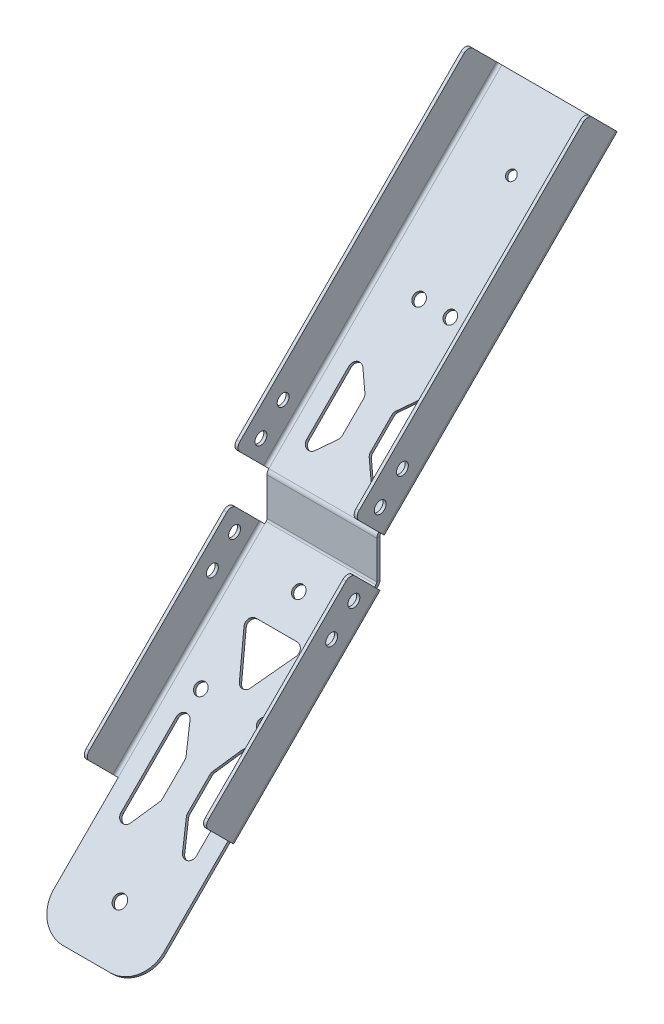
from build123d import *

# Parameters (mm, degrees)
BASE_FLANGE1_DEPTH     = 1
SKETCHED_START         = -32.5
SKETCHED_BEND5_DEPTH   = 65
SKETCHED_BEND5_2_DEPTH = 15
SKETCHED_START_2       = 17.5
SKETCHED_BEND5_3_DEPTH = 15
SKETCHED_BEND5_4_DEPTH = 65
SKETCHED_START_3       = -17.5
SKETCHED_BEND5_5_DEPTH = 35
SKETCHED_BEND6_DEPTH   = 65
SKETCHED_BEND6_2_DEPTH = 15
SKETCHED_BEND6_3_DEPTH = 15
SKETCHED_BEND6_4_DEPTH = 65
SKETCHED_BEND6_5_DEPTH = 35
SKETCHED_START_4       = -71.356310605
SKETCHED_BEND7_DEPTH   = 66
SKETCHED_BEND7_2_DEPTH = 66
SKETCHED_START_5       = 5.890889039
SKETCHED_BEND8_DEPTH   = 105
SKETCHED_BEND8_2_DEPTH = 105
F_6_CLEARANCE_HOLE2_D  = 3.7973
CUT_EXTRUDE1_REACH     = 121.977
SKETCH16_R             = 1.525
CUT_EXTRUDE2_REACH     = 127.221
SKETCH31_R             = 2.025
F_6_CLEARANCE_HOLE4_D  = 3.7973
F_6_CLEARANCE_HOLE5_D  = 3.7973
FILLET1_R              = 10
FILLET2_R              = 2


# Read off the part's stored shape, not the designer's step: Sketched Bend5, Sketched Bend6, Sketched Bend7, Sketched Bend8
# Sheet-metal steps are written as plain solids
with BuildPart() as part:
    # Sketch1 → Base-Flange1 (new body)
    with BuildSketch(Plane.XY):
        Polygon((-32.5, -73.5), (-17.5, -73.5), (-17.5, -112.5), (17.5, -112.5), (17.5, -73.5), (32.5, -73.5), (32.5, -7.5), (17.5, -7.5), (17.5, 7.5), (32.5, 7.5), (32.5, 112.5), (17.5, 112.5), (-17.5, 112.5), (-32.5, 112.5), (-32.5, 7.5), (-17.5, 7.5), (-17.5, -7.5), (-32.5, -7.5), align=None)
    extrude(amount=-BASE_FLANGE1_DEPTH)

    # Sketched Bend5 outline → Sketched Bend5 (cut)
    with BuildSketch(Plane.YZ.offset(SKETCHED_START)):
        with BuildLine():
            Line((7.714213562, -0.585786438), (8.128427124, -1))
            Line((8.128427124, -1), (112.5, -1))
            Line((112.5, -1), (112.5, 0))
            Line((112.5, 0), (6.3, 0))
            ThreePointArc((6.3, 0), (7.065366865, -0.152240935), (7.714213562, -0.585786438))
        make_face()
    extrude(amount=SKETCHED_BEND5_DEPTH, mode=Mode.SUBTRACT)

    # Sketched Bend5 2 outline → Sketched Bend5 2 (cut)
    with BuildSketch(Plane.YZ.offset(SKETCHED_START)):
        with BuildLine():
            Line((7.729701149, -0.601274024), (7.714213562, -0.585786438))
            ThreePointArc((7.714213562, -0.585786438), (7.610403483, -0.48909209), (7.5, -0.4))
            Line((7.5, -0.4), (7.5, -0.830975173))
            Line((7.5, -0.830975173), (7.729701149, -0.601274024))
        make_face()
    extrude(amount=SKETCHED_BEND5_2_DEPTH, mode=Mode.SUBTRACT)

    # Sketched Bend5 3 outline → Sketched Bend5 3 (cut)
    with BuildSketch(Plane.YZ.offset(SKETCHED_START_2)):
        with BuildLine():
            Line((7.729701149, -0.601274024), (7.714213562, -0.585786438))
            ThreePointArc((7.714213562, -0.585786438), (7.610403483, -0.48909209), (7.5, -0.4))
            Line((7.5, -0.4), (7.5, -0.830975173))
            Line((7.5, -0.830975173), (7.729701149, -0.601274024))
        make_face()
    extrude(amount=SKETCHED_BEND5_3_DEPTH, mode=Mode.SUBTRACT)

    # Sketched Bend5 4 outline → Sketched Bend5 4 (add)
    with BuildSketch(Plane.YZ.offset(SKETCHED_START)):
        Polygon((81.975913173, -74.847486049), (8.128427124, -1), (7.5, -1), (7.5, -0.830975173), (7.022594368, -1.308380805), (81.268806392, -75.55459283), align=None)
    extrude(amount=SKETCHED_BEND5_4_DEPTH)

    # Sketched Bend5 5 outline → Sketched Bend5 5 (add)
    with BuildSketch(Plane.YZ.offset(SKETCHED_START_3)):
        with BuildLine():
            Line((7.022594368, -1.308380805), (7.330975173, -1))
            Line((7.330975173, -1), (6.3, -1))
            ThreePointArc((6.3, -1), (6.682683432, -1.076120467), (7.007106781, -1.292893219))
            Line((7.007106781, -1.292893219), (7.022594368, -1.308380805))
        make_face()
    extrude(amount=SKETCHED_BEND5_5_DEPTH)

    # Sketched Bend6 outline → Sketched Bend6 (cut)
    with BuildSketch(Plane.YZ.offset(SKETCHED_START)):
        with BuildLine():
            ThreePointArc((-5.710951377, -1), (-6.476318242, -0.847759065), (-7.12516494, -0.414213562))
            Line((-7.12516494, -0.414213562), (-7.539378502, 0))
            Line((-7.539378502, 0), (-112.5, 0))
            Line((-112.5, 0), (-112.5, -1))
            Line((-112.5, -1), (-5.710951377, -1))
        make_face()
    extrude(amount=SKETCHED_BEND6_DEPTH, mode=Mode.SUBTRACT)

    # Sketched Bend6 2 outline → Sketched Bend6 2 (cut)
    with BuildSketch(Plane.YZ.offset(SKETCHED_START)):
        Polygon((-7.539378502, 0), (-7.5, -0.039378502), (-7.5, 0), align=None)
    extrude(amount=SKETCHED_BEND6_2_DEPTH, mode=Mode.SUBTRACT)

    # Sketched Bend6 3 outline → Sketched Bend6 3 (cut)
    with BuildSketch(Plane.YZ.offset(SKETCHED_START_2)):
        Polygon((-7.539378502, 0), (-7.5, -0.039378502), (-7.5, 0), align=None)
    extrude(amount=SKETCHED_BEND6_3_DEPTH, mode=Mode.SUBTRACT)



with BuildPart() as body_2:
    # Sketched Bend6 4 outline → Sketched Bend6 4 (new body)
    with BuildSketch(Plane.YZ.offset(SKETCHED_START)):
        Polygon((-54.22622036, 46.686841858), (-7.557172802, 0.0177943), (-6.850066021, 0.724901081), (-53.519113579, 47.393948639), align=None)
    extrude(amount=SKETCHED_BEND6_4_DEPTH)


with BuildPart() as part_1:
    add(part.part)

    add(body_2.part)  # Sketched Bend6 5 merges body 2
    # Sketched Bend6 5 outline → Sketched Bend6 5 (add)
    with BuildSketch(Plane.YZ.offset(SKETCHED_START_3)):
        with BuildLine():
            Line((-7.557172802, 0.0177943), (-7.539378502, 0))
            Line((-7.539378502, 0), (-5.710951377, 0))
            ThreePointArc((-5.710951377, 0), (-6.09363481, 0.076120467), (-6.418058159, 0.292893219))
            Line((-6.418058159, 0.292893219), (-6.850066021, 0.724901081))
            Line((-6.850066021, 0.724901081), (-7.557172802, 0.0177943))
        make_face()
        Polygon((-81.803384826, 74.264006324), (-54.22622036, 46.686841858), (-53.519113579, 47.393948639), (-81.096278045, 74.971113105), align=None)
    extrude(amount=SKETCHED_BEND6_5_DEPTH)

    # Sketched Bend7 outline → Sketched Bend7 (cut)
    with BuildSketch(Plane(origin=(0, 0, 0), x_dir=(1, 0, 0), z_dir=(0, 0.707106781186546, -0.707106781186549)).offset(SKETCHED_START_4)):
        with BuildLine():
            ThreePointArc((-19.232050807, 4.331145665), (-18.5, 5.063196472), (-17.5, 5.331145665))
            Line((-17.5, 5.331145665), (-32.5, 5.331145665))
            Line((-32.5, 5.331145665), (-32.5, 4.331145665))
            Line((-32.5, 4.331145665), (-19.232050807, 4.331145665))
        make_face()
        with BuildLine():
            Line((32.5, 5.331145665), (17.5, 5.331145665))
            ThreePointArc((17.5, 5.331145665), (18.5, 5.063196472), (19.232050807, 4.331145665))
            Line((19.232050807, 4.331145665), (32.5, 4.331145665))
            Line((32.5, 4.331145665), (32.5, 5.331145665))
        make_face()
    extrude(amount=SKETCHED_BEND7_DEPTH, mode=Mode.SUBTRACT)

    # Sketched Bend7 2 outline → Sketched Bend7 2 (add)
    with BuildSketch(Plane(origin=(0, 0, 0), x_dir=(1, 0, 0), z_dir=(0, 0.707106781186546, -0.707106781186549)).offset(SKETCHED_START_4)):
        with BuildLine():
            Line((-17.5, 4.331145665), (-19.232050807, 4.331145665))
            ThreePointArc((-19.232050807, 4.331145665), (-19.431851652, 3.848783755), (-19.5, 3.331145665))
            Line((-19.5, 3.331145665), (-19.5, -9.312659845))
            Line((-19.5, -9.312659845), (-18.5, -9.312659845))
            Line((-18.5, -9.312659845), (-18.5, 3.331145665))
            ThreePointArc((-18.5, 3.331145665), (-18.207106781, 4.038252446), (-17.5, 4.331145665))
        make_face()
        with BuildLine():
            ThreePointArc((19.5, 3.331145665), (19.431851652, 3.848783755), (19.232050807, 4.331145665))
            Line((19.232050807, 4.331145665), (17.5, 4.331145665))
            ThreePointArc((17.5, 4.331145665), (18.207106781, 4.038252446), (18.5, 3.331145665))
            Line((18.5, 3.331145665), (18.5, -9.312659845))
            Line((18.5, -9.312659845), (19.5, -9.312659845))
            Line((19.5, -9.312659845), (19.5, 3.331145665))
        make_face()
    extrude(amount=SKETCHED_BEND7_2_DEPTH)

    # Sketched Bend8 outline → Sketched Bend8 (cut)
    with BuildSketch(Plane(origin=(0, 0, 0), x_dir=(1, 0, 0), z_dir=(0, 0.707106781186546, -0.707106781186549)).offset(SKETCHED_START_5)):
        with BuildLine():
            Line((-32.5, -5.040559159), (-19.232050807, -5.040559159))
            ThreePointArc((-19.232050807, -5.040559159), (-18.5, -4.308508352), (-17.5, -4.040559159))
            Line((-17.5, -4.040559159), (-32.5, -4.040559159))
            Line((-32.5, -4.040559159), (-32.5, -5.040559159))
        make_face()
        with BuildLine():
            Line((32.5, -4.040559159), (17.5, -4.040559159))
            ThreePointArc((17.5, -4.040559159), (18.5, -4.308508352), (19.232050807, -5.040559159))
            Line((19.232050807, -5.040559159), (32.5, -5.040559159))
            Line((32.5, -5.040559159), (32.5, -4.040559159))
        make_face()
    extrude(amount=SKETCHED_BEND8_DEPTH, mode=Mode.SUBTRACT)

    # Sketched Bend8 2 outline → Sketched Bend8 2 (add)
    with BuildSketch(Plane(origin=(0, 0, 0), x_dir=(1, 0, 0), z_dir=(0, 0.707106781186546, -0.707106781186549)).offset(SKETCHED_START_5)):
        with BuildLine():
            ThreePointArc((-19.232050807, -5.040559159), (-19.431851652, -5.522921069), (-19.5, -6.040559159))
            Line((-19.5, -6.040559159), (-19.5, -18.684364669))
            Line((-19.5, -18.684364669), (-18.5, -18.684364669))
            Line((-18.5, -18.684364669), (-18.5, -6.040559159))
            ThreePointArc((-18.5, -6.040559159), (-18.207106781, -5.333452378), (-17.5, -5.040559159))
            Line((-17.5, -5.040559159), (-19.232050807, -5.040559159))
        make_face()
        with BuildLine():
            Line((19.232050807, -5.040559159), (17.5, -5.040559159))
            ThreePointArc((17.5, -5.040559159), (18.207106781, -5.333452378), (18.5, -6.040559159))
            Line((18.5, -6.040559159), (18.5, -18.684364669))
            Line((18.5, -18.684364669), (19.5, -18.684364669))
            Line((19.5, -18.684364669), (19.5, -6.040559159))
            ThreePointArc((19.5, -6.040559159), (19.431851652, -5.522921069), (19.232050807, -5.040559159))
        make_face()
    extrude(amount=SKETCHED_BEND8_2_DEPTH)

    # #6 Clearance Hole2 (through all)
    with Locations(Plane(origin=(19.5, 0, 0), x_dir=(0, 0, -1), z_dir=(1, 0, 0))):
        with Locations((-9.311868306, -5.334166607), (-16.382936118, -12.405234419), (-0.914625389, 16.316668374), (6.156442422, 23.387736186)):
            Hole(F_6_CLEARANCE_HOLE2_D / 2)

    # Sketch16 → Cut-Extrude1 (cut, up to next)
    with BuildSketch(Plane(origin=(0, 3.564213562, 3.564213562), x_dir=(1, 0, 0), z_dir=(0, 0.7071067811865487, 0.7071067811865465)), mode=Mode.PRIVATE) as cut_extrude1_sk1:
        with Locations(Location((0, 90.430889039, 0), (0, 0, 270))):
            Circle(SKETCH16_R)
    cut_extrude1_tool1 = extrude(cut_extrude1_sk1.sketch, amount=-CUT_EXTRUDE1_REACH, mode=Mode.PRIVATE) & part_1.part
    # Sketch16 → Cut-Extrude1 (cut, up to next)
    with BuildSketch(Plane(origin=(0, 3.564213562, 3.564213562), x_dir=(1, 0, 0), z_dir=(0, 0.7071067811865487, 0.7071067811865465)), mode=Mode.PRIVATE) as cut_extrude1_sk2:
        with BuildLine():
            Line((-12.5, 34.910953453), (-12.5, 15.870824627))
            ThreePointArc((-12.5, 15.870824627), (-11.185694979, 13.992042469), (-8.970177604, 14.582553136))
            Line((-8.970177604, 14.582553136), (-4.970177604, 19.332553136))
            ThreePointArc((-4.970177604, 19.332553136), (-4.621217842, 19.935129648), (-4.5, 20.620824627))
            Line((-4.5, 20.620824627), (-4.5, 30.160953453))
            ThreePointArc((-4.5, 30.160953453), (-4.621217842, 30.846648432), (-4.970177604, 31.449224944))
            Line((-4.970177604, 31.449224944), (-8.970177604, 36.199224944))
            ThreePointArc((-8.970177604, 36.199224944), (-11.185694979, 36.789735611), (-12.5, 34.910953453))
        make_face()
    cut_extrude1_tool2 = extrude(cut_extrude1_sk2.sketch, amount=-CUT_EXTRUDE1_REACH, mode=Mode.PRIVATE) & part_1.part
    # Sketch16 → Cut-Extrude1 (cut, up to next)
    with BuildSketch(Plane(origin=(0, 3.564213562, 3.564213562), x_dir=(1, 0, 0), z_dir=(0, 0.7071067811865487, 0.7071067811865465)), mode=Mode.PRIVATE) as cut_extrude1_sk3:
        with BuildLine():
            Line((4.5, 20.620824627), (4.5, 30.160953453))
            ThreePointArc((4.5, 30.160953453), (4.621217842, 30.846648432), (4.970177604, 31.449224944))
            Line((4.970177604, 31.449224944), (8.970177604, 36.199224944))
            ThreePointArc((8.970177604, 36.199224944), (11.185694979, 36.789735611), (12.5, 34.910953453))
            Line((12.5, 34.910953453), (12.5, 15.870824627))
            ThreePointArc((12.5, 15.870824627), (11.185694979, 13.992042469), (8.970177604, 14.582553136))
            Line((8.970177604, 14.582553136), (4.970177604, 19.332553136))
            ThreePointArc((4.970177604, 19.332553136), (4.621217842, 19.935129648), (4.5, 20.620824627))
        make_face()
    cut_extrude1_tool3 = extrude(cut_extrude1_sk3.sketch, amount=-CUT_EXTRUDE1_REACH, mode=Mode.PRIVATE) & part_1.part
    add(cut_extrude1_tool1.solids().sort_by_distance((0, 67.508508, -60.380081))[0], mode=Mode.SUBTRACT)
    add(cut_extrude1_tool2.solids().sort_by_distance((-8.925772, 21.518283, -14.389856))[0], mode=Mode.SUBTRACT)
    add(cut_extrude1_tool3.solids().sort_by_distance((8.925772, 21.518283, -14.389856))[0], mode=Mode.SUBTRACT)

    # Sketch31 → Cut-Extrude2 (cut, up to next)
    with BuildSketch(Plane(origin=(0, -3.769689251, -3.769689251), x_dir=(-1, 0, 0), z_dir=(0, -0.7071067811865487, -0.7071067811865465)), mode=Mode.PRIVATE) as cut_extrude2_sk1:
        with Locations(Location((0, -95.356310605, 0), (0, 0, 90))):
            Circle(SKETCH31_R)
    cut_extrude2_tool1 = extrude(cut_extrude2_sk1.sketch, amount=-CUT_EXTRUDE2_REACH, mode=Mode.PRIVATE) & part_1.part
    # Sketch31 → Cut-Extrude2 (cut, up to next)
    with BuildSketch(Plane(origin=(0, -3.769689251, -3.769689251), x_dir=(-1, 0, 0), z_dir=(0, -0.7071067811865487, -0.7071067811865465)), mode=Mode.PRIVATE) as cut_extrude2_sk2:
        with BuildLine():
            Line((1.732050808, -39.065867303), (8.267949192, -27.745359227))
            ThreePointArc((8.267949192, -27.745359227), (8.267949192, -25.745359227), (6.535898385, -24.745359227))
            Line((6.535898385, -24.745359227), (-6.535898385, -24.745359227))
            ThreePointArc((-6.535898385, -24.745359227), (-8.267949192, -25.745359227), (-8.267949192, -27.745359227))
            Line((-8.267949192, -27.745359227), (-1.732050808, -39.065867303))
            ThreePointArc((-1.732050808, -39.065867303), (0, -40.065867303), (1.732050808, -39.065867303))
        make_face()
    cut_extrude2_tool2 = extrude(cut_extrude2_sk2.sketch, amount=-CUT_EXTRUDE2_REACH, mode=Mode.PRIVATE) & part_1.part
    # Sketch31 → Cut-Extrude2 (cut, up to next)
    with BuildSketch(Plane(origin=(0, -3.769689251, -3.769689251), x_dir=(-1, 0, 0), z_dir=(0, -0.7071067811865487, -0.7071067811865465)), mode=Mode.PRIVATE) as cut_extrude2_sk3:
        with BuildLine():
            Line((-12, -53.065867303), (-12, -77.856310605))
            ThreePointArc((-12, -77.856310605), (-10.490758652, -79.795164891), (-8.240844055, -78.807820122))
            Line((-8.240844055, -78.807820122), (-4.240844055, -71.412598471))
            ThreePointArc((-4.240844055, -71.412598471), (-4.061145713, -70.951847606), (-4, -70.461088954))
            Line((-4, -70.461088954), (-4, -60.461088954))
            ThreePointArc((-4, -60.461088954), (-4.061145713, -59.970330301), (-4.240844055, -59.509579437))
            Line((-4.240844055, -59.509579437), (-8.240844055, -52.114357786))
            ThreePointArc((-8.240844055, -52.114357786), (-10.490758652, -51.127013016), (-12, -53.065867303))
        make_face()
    cut_extrude2_tool3 = extrude(cut_extrude2_sk3.sketch, amount=-CUT_EXTRUDE2_REACH, mode=Mode.PRIVATE) & part_1.part
    # Sketch31 → Cut-Extrude2 (cut, up to next)
    with BuildSketch(Plane(origin=(0, -3.769689251, -3.769689251), x_dir=(-1, 0, 0), z_dir=(0, -0.7071067811865487, -0.7071067811865465)), mode=Mode.PRIVATE) as cut_extrude2_sk4:
        with BuildLine():
            Line((4, -70.461088954), (4, -60.461088954))
            ThreePointArc((4, -60.461088954), (4.061145713, -59.970330301), (4.240844055, -59.509579437))
            Line((4.240844055, -59.509579437), (8.240844055, -52.114357786))
            ThreePointArc((8.240844055, -52.114357786), (10.490758652, -51.127013016), (12, -53.065867303))
            Line((12, -53.065867303), (12, -77.856310605))
            ThreePointArc((12, -77.856310605), (10.490758652, -79.795164891), (8.240844055, -78.807820122))
            Line((8.240844055, -78.807820122), (4.240844055, -71.412598471))
            ThreePointArc((4.240844055, -71.412598471), (4.061145713, -70.951847606), (4, -70.461088954))
        make_face()
    cut_extrude2_tool4 = extrude(cut_extrude2_sk4.sketch, amount=-CUT_EXTRUDE2_REACH, mode=Mode.PRIVATE) & part_1.part
    add(cut_extrude2_tool1.solids().sort_by_distance((0, -71.196783, 63.657405))[0], mode=Mode.SUBTRACT)
    add(cut_extrude2_tool2.solids().sort_by_distance((0, -25.349783, 17.810405))[0], mode=Mode.SUBTRACT)
    add(cut_extrude2_tool3.solids().sort_by_distance((8.518356, -50.057669, 42.518291))[0], mode=Mode.SUBTRACT)
    add(cut_extrude2_tool4.solids().sort_by_distance((-8.518356, -50.057669, 42.518291))[0], mode=Mode.SUBTRACT)

    # #6 Clearance Hole4 (through all)
    with Locations(Plane(origin=(0, -3.769689251, -3.769689251), x_dir=(-1, 0, 0), z_dir=(0, -0.7071067811865487, -0.7071067811865465))):
        with Locations((-10, -44.745359227), (10, -44.745359227), (0, -14.745359227)):
            Hole(F_6_CLEARANCE_HOLE4_D / 2)

    # #6 Clearance Hole5 (through all)
    with Locations(Plane(origin=(0, 2.857106781, 2.857106781), x_dir=(-1, 0, 0), z_dir=(0, -0.7071067811865487, -0.7071067811865465))):
        with Locations((4.97, 55.870889039), (-4.97, 55.870889039)):
            Hole(F_6_CLEARANCE_HOLE5_D / 2)

    # Fillet1
    fillet1_edges = [part_1.edges().sort_by_distance(p)[0] for p in [
        (-17.5, -81.449831436, 74.617559715),
        (17.5, -81.449831436, 74.617559715),
    ]]
    fillet(fillet1_edges, radius=FILLET1_R)

    # Fillet2
    fillet2_edges = [part_1.edges().sort_by_distance(p)[0] for p in [
        (-19, -43.871486182, 57.041576037),
        (-19, 2.797561376, 10.372528478),
        (19, 2.797561376, 10.372528478),
        (19, -43.871486182, 57.041576037),
        (-19, 17.377328546, 9.046353373),
        (-19, 91.623540571, -65.199858652),
        (19, 91.623540571, -65.199858652),
        (19, 17.377328546, 9.046353373),
    ]]
    fillet(fillet2_edges, radius=FILLET2_R)


solid = part_1.part
